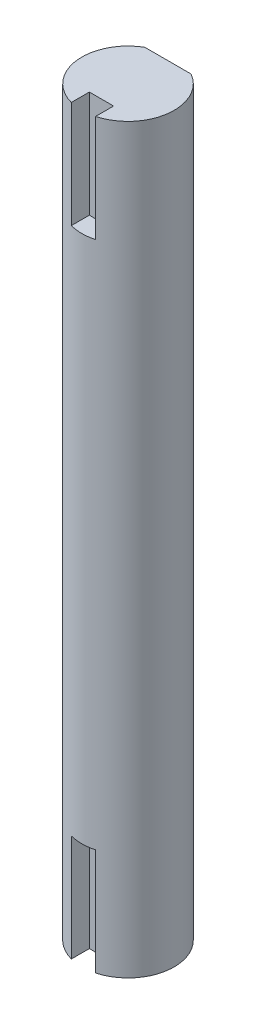
from build123d import *

# Parameters (mm, degrees)
BOSS_EXTRUDE1_DEPTH      = 38.25
BOSS_EXTRUDE1_DEPTH_BACK = 38.249999954
CUT_EXTRUDE1_DEPTH       = 77.795916594
CUT_EXTRUDE1_DEPTH_BACK  = 11
CUT_EXTRUDE2_START       = -11
CUT_EXTRUDE2_DEPTH       = 11


with BuildPart() as part:
    # Sketch1 → Boss-Extrude1 (new, two sides: drawn at the far end of the back side and taken through both)
    with BuildSketch(Plane(origin=(0, 0, 0), x_dir=(1, 0, 0), z_dir=(0, 1, 0)).offset(-BOSS_EXTRUDE1_DEPTH_BACK)):
        with BuildLine():
            Line((2.3876, 4.120773288), (-2.3876, 4.120773288))
            ThreePointArc((-2.3876, 4.120773288), (-2.378072881, -4.126278665), (4.7625, 0))
            ThreePointArc((4.7625, 0), (4.126278665, 2.378072881), (2.3876, 4.120773288))
        make_face()
    extrude(amount=BOSS_EXTRUDE1_DEPTH + BOSS_EXTRUDE1_DEPTH_BACK)

    # Sketch2 → Cut-Extrude1 (cut, two sides: drawn at the far end of the back side and taken through both)
    with BuildSketch(Plane.XZ.offset(38.249999954).offset(-CUT_EXTRUDE1_DEPTH_BACK)):
        Polygon((-1.25, 35.773266476), (-1.25, 4.595531117), (-1.25, 2.7375), (1.25, 2.7375), (1.25, 4.595531117), (1.25, 35.773266476), (1.25, 98.128737194), (-1.25, 98.128737194), align=None)
    extrude(amount=CUT_EXTRUDE1_DEPTH + CUT_EXTRUDE1_DEPTH_BACK, mode=Mode.SUBTRACT)

    # Sketch3 → Cut-Extrude2 (cut)
    with BuildSketch(Plane(origin=(0, 38.25, 0), x_dir=(1, 0, 0), z_dir=(0, 1, 0)).offset(CUT_EXTRUDE2_START)):
        with BuildLine():
            Line((-1.25, -4.595531117), (-1.25, -2.7375))
            Line((-1.25, -2.7375), (1.25, -2.7375))
            Line((1.25, -2.7375), (1.25, -4.595531117))
            ThreePointArc((1.25, -4.595531117), (0, -4.7625), (-1.25, -4.595531117))
        make_face()
    extrude(amount=CUT_EXTRUDE2_DEPTH, mode=Mode.SUBTRACT)


solid = part.part
